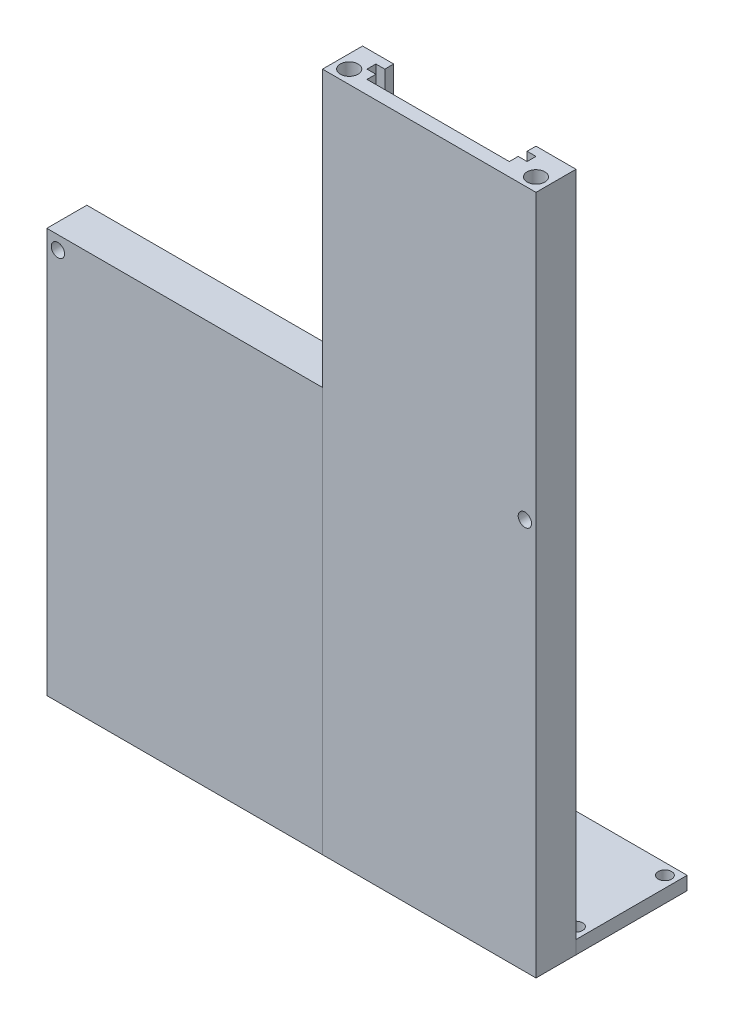
from build123d import *

# Parameters (mm, degrees)
P_IDAT_VYSUNUT_M1_DEPTH           = 6
SKICA2_W                          = 48
SKICA2_H                          = 153
P_IDAT_VYSUNUT_M2_DEPTH           = 3
SKICA5_W                          = 62
SKICA5_H                          = 91
P_IDAT_VYSUNUT_M4_DEPTH           = 7.5
SKICA7_W                          = 62
SKICA7_H                          = 91
SKICA7_W_2                        = 56
SKICA7_H_2                        = 85
P_IDAT_VYSUNUT_M5_DEPTH           = 1.5
P_IDAT_VYSUNUT_M6_DEPTH           = 153
SKICA9_W                          = 7
SKICA9_H                          = 28
SKICA9_W_2                        = 3
ODEBRAT_VYSUNUT_M2_DEPTH          = 1.5
SKICA10_W                         = 110
SKICA10_H                         = 3
P_IDAT_VYSUNUT_M7_DEPTH           = 25
SKICA11_R                         = 2.5
ODEBRAT_VYSUNUT_M3_DEPTH          = 166.378354085
VYSUNOUT_START                    = -4.5
VYSUNOUT_TENKOST_NN_1_OUTLINE_R   = 5
VYSUNOUT_TENKOST_NN_1_OUTLINE_R_2 = 2
VYSUNOUT_TENKOST_NN_1_DEPTH       = 6
SKICA13_R                         = 2
ODEBRAT_VYSUNUT_M4_DEPTH          = 5
ODEBRAT_VYSUNUT_M6_DEPTH          = 169.104134393
ODEBRAT_VYSUNUT_M6_DEPTH_BACK     = 169.104134393
SKICA14_R                         = 1.5
ODEBRAT_VYSUNUT_M7_DEPTH          = 167.976046186
ODEBRAT_VYSUNUT_M7_DEPTH_BACK     = 167.976046186
SKICA15_R                         = 1.5
P_IDAT_VYSUNUT_M8_DEPTH           = 1.5


# Read off the part's stored shape, not the designer's step: Vysunout tenkostěnný1
with BuildPart() as part:
    # Skica1 → Přidat vysunutím1 (new body)
    with BuildSketch(Plane.XY):
        Polygon((40, -3), (45, -3), (45, 150), (40, 150), (40, 0), (0, 0), (0, 150), (-3, 150), (-3, -3), (0, -3), align=None)
    extrude(amount=P_IDAT_VYSUNUT_M1_DEPTH)

    # Skica2 → Přidat vysunutím2 (add)
    with BuildSketch(Plane.XY.offset(6)):
        with Locations((21, 73.5)):
            Rectangle(SKICA2_W, SKICA2_H)
    extrude(amount=P_IDAT_VYSUNUT_M2_DEPTH)

    # Skica3 → Přidat vysunutím6 (add, through all)
    with BuildSketch(Plane.XZ.offset(3)):
        Polygon((0, 0), (4, 0), (4, 2), (2, 2), (2, 4), (4, 4), (4, 6), (0, 6), align=None)
        Polygon((40, 0), (36, 0), (36, 2), (38, 2), (38, 4), (36, 4), (36, 6), (40, 6), align=None)
    extrude(amount=-P_IDAT_VYSUNUT_M6_DEPTH)


with BuildPart() as body_2:
    # Skica5 → Přidat vysunutím4 (new body)
    with BuildSketch(Plane.XY.offset(9)):
        with Locations((-34, 42.5)):
            Rectangle(SKICA5_W, SKICA5_H)
    extrude(amount=-P_IDAT_VYSUNUT_M4_DEPTH)

    # Skica7 → Přidat vysunutím5 (add, through all)
    with BuildSketch(Plane(origin=(0, 0, 1.5), x_dir=(-1, 0, 0), z_dir=(0, 0, -1))):
        with Locations((34, 42.5)):
            Rectangle(SKICA7_W, SKICA7_H)
        with Locations((34, 42.5)):
            Rectangle(SKICA7_W_2, SKICA7_H_2, mode=Mode.SUBTRACT)
    extrude(amount=P_IDAT_VYSUNUT_M5_DEPTH)


with BuildPart() as odebrat_vysunut_m2_tool:
    # Skica9 → Odebrat vysunutím2 (new body)
    with BuildSketch(Plane(origin=(0, 0, 0), x_dir=(-1, 0, 0), z_dir=(0, 0, -1))):
        with Locations((-0.5, 71)):
            Rectangle(SKICA9_W, SKICA9_H)
        with Locations((4.5, 71)):
            Rectangle(SKICA9_W_2, SKICA9_H)
    extrude(amount=-ODEBRAT_VYSUNUT_M2_DEPTH)


with BuildPart() as part_1:
    add(part.part)

    # Odebrat vysunutím2: cut by odebrat_vysunut_m2_tool
    add(odebrat_vysunut_m2_tool.part, mode=Mode.SUBTRACT)

    # Skica13 → Odebrat vysunutím4 (cut)
    with BuildSketch(Plane(origin=(0, 150, 0), x_dir=(1, 0, 0), z_dir=(0, 1, 0))):
        with Locations(Location((42, -6, 0), (0, 0, 270))):
            Circle(SKICA13_R)
        with Locations(Location((0, -6, 0), (0, 0, 270))):
            Circle(SKICA13_R)
    extrude(amount=-ODEBRAT_VYSUNUT_M4_DEPTH, mode=Mode.SUBTRACT)


with BuildPart() as body_2_1:
    add(body_2.part)

    # Odebrat vysunutím2: cut by odebrat_vysunut_m2_tool
    add(odebrat_vysunut_m2_tool.part, mode=Mode.SUBTRACT)


with BuildPart() as body_3:
    # Skica10 → Přidat vysunutím7 (new body)
    with BuildSketch(Plane(origin=(0, 0, 0), x_dir=(-1, 0, 0), z_dir=(0, 0, -1))):
        with Locations((10, -1.5)):
            Rectangle(SKICA10_W, SKICA10_H)
    extrude(amount=P_IDAT_VYSUNUT_M7_DEPTH)

    # Skica11 → Odebrat vysunutím3 (cut, through all)
    with BuildSketch(Plane(origin=(0, 0, 0), x_dir=(1, 0, 0), z_dir=(0, 1, 0))):
        with Locations(Location((-18, 5, 0), (0, 0, 270))):
            Circle(SKICA11_R)
        with BuildLine():
            Line((-33, 3.5), (-39, 3.5))
            ThreePointArc((-39, 3.5), (-40.5, 5), (-39, 6.5))
            Line((-39, 6.5), (-33, 6.5))
            ThreePointArc((-33, 6.5), (-31.5, 5), (-33, 3.5))
        make_face()
    extrude(amount=-ODEBRAT_VYSUNUT_M3_DEPTH, mode=Mode.SUBTRACT)

    # Skica14 → Odebrat vysunutím6 (cut, two sides: drawn at the far end of the back side and taken through both)
    with BuildSketch(Plane.XZ.offset(3).offset(-ODEBRAT_VYSUNUT_M6_DEPTH_BACK)):
        with Locations(Location((-62.5, -2.5, 0), (0, 0, 270))):
            Circle(SKICA14_R)
        with Locations(Location((-62.5, -22.5, 0), (0, 0, 270))):
            Circle(SKICA14_R)
        with Locations(Location((42.5, -2.5, 0), (0, 0, 270))):
            Circle(SKICA14_R)
        with Locations(Location((42.5, -22.5, 0), (0, 0, 270))):
            Circle(SKICA14_R)
    extrude(amount=ODEBRAT_VYSUNUT_M6_DEPTH + ODEBRAT_VYSUNUT_M6_DEPTH_BACK, mode=Mode.SUBTRACT)


with BuildPart() as body_4:
    # Vysunout tenkostěnný1 outline → Vysunout tenkostěnný1 (new body)
    # profile 1 of 4: a face of its own
    with BuildSketch(Plane(origin=(0, 0, 1.5), x_dir=(-1, 0, 0), z_dir=(0, 0, -1)).offset(VYSUNOUT_START)):
        with Locations((51, 16)):
            Circle(VYSUNOUT_TENKOST_NN_1_OUTLINE_R)
        with Locations((51, 16)):
            Circle(VYSUNOUT_TENKOST_NN_1_OUTLINE_R_2, mode=Mode.SUBTRACT)
    # profile 2 of 4: a face of its own
    with BuildSketch(Plane(origin=(0, 0, 1.5), x_dir=(-1, 0, 0), z_dir=(0, 0, -1)).offset(VYSUNOUT_START)):
        with Locations((-26, 73)):
            Circle(VYSUNOUT_TENKOST_NN_1_OUTLINE_R)
        with Locations((-26, 73)):
            Circle(VYSUNOUT_TENKOST_NN_1_OUTLINE_R_2, mode=Mode.SUBTRACT)
    # profile 3 of 4: a face of its own
    with BuildSketch(Plane(origin=(0, 0, 1.5), x_dir=(-1, 0, 0), z_dir=(0, 0, -1)).offset(VYSUNOUT_START)):
        with Locations((29, 73)):
            Circle(VYSUNOUT_TENKOST_NN_1_OUTLINE_R)
        with Locations((29, 73)):
            Circle(VYSUNOUT_TENKOST_NN_1_OUTLINE_R_2, mode=Mode.SUBTRACT)
    # profile 4 of 4: a face of its own
    with BuildSketch(Plane(origin=(0, 0, 1.5), x_dir=(-1, 0, 0), z_dir=(0, 0, -1)).offset(VYSUNOUT_START)):
        with Locations((51, 71)):
            Circle(VYSUNOUT_TENKOST_NN_1_OUTLINE_R)
        with Locations((51, 71)):
            Circle(VYSUNOUT_TENKOST_NN_1_OUTLINE_R_2, mode=Mode.SUBTRACT)
    extrude(amount=VYSUNOUT_TENKOST_NN_1_DEPTH)


with BuildPart() as odebrat_vysunut_m7_tool:
    # Skica15 → Odebrat vysunutím7 (new, two sides: drawn at the far end of the back side and taken through both)
    with BuildSketch(Plane.XY.offset(9).offset(-ODEBRAT_VYSUNUT_M7_DEPTH_BACK)):
        with Locations((-62.5, 85)):
            Circle(SKICA15_R)
        with Locations((42.5, 85)):
            Circle(SKICA15_R)
    extrude(amount=ODEBRAT_VYSUNUT_M7_DEPTH + ODEBRAT_VYSUNUT_M7_DEPTH_BACK)


with BuildPart() as part_2:
    add(part_1.part)

    # Odebrat vysunutím7: cut by odebrat_vysunut_m7_tool
    add(odebrat_vysunut_m7_tool.part, mode=Mode.SUBTRACT)


with BuildPart() as body_2_2:
    add(body_2_1.part)

    # Odebrat vysunutím7: cut by odebrat_vysunut_m7_tool
    add(odebrat_vysunut_m7_tool.part, mode=Mode.SUBTRACT)

    # Skica16 → Přidat vysunutím8 (add)
    with BuildSketch(Plane(origin=(0, 0, 1.5), x_dir=(-1, 0, 0), z_dir=(0, 0, -1))):
        with BuildLine():
            Line((62, 82.550510257), (62, 83.585786438))
            ThreePointArc((62, 83.585786438), (61.275255129, 84.133974596), (61, 85))
            Line((61, 85), (60, 85))
            ThreePointArc((60, 85), (60.563508327, 83.41886117), (62, 82.550510257))
        make_face()
    extrude(amount=P_IDAT_VYSUNUT_M8_DEPTH)


solid = Compound([body_3.part, body_4.part, part_2.part, body_2_2.part])
